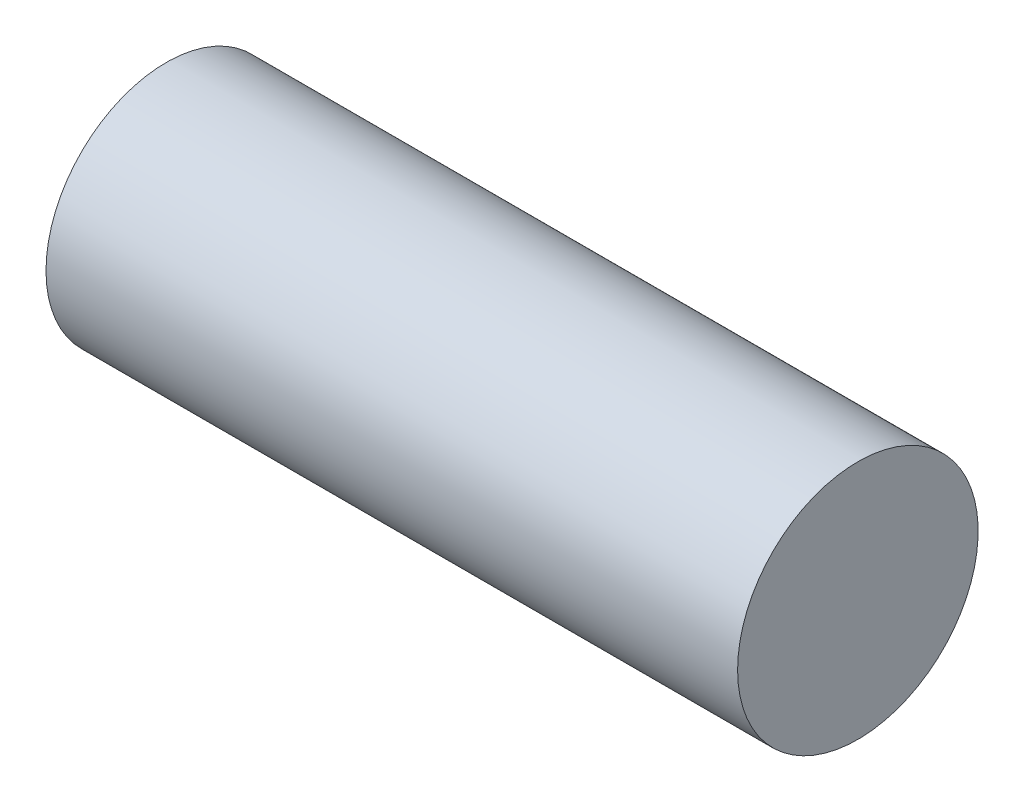
from build123d import *

# Parameters (mm, degrees)
SKETCH2_W = 6.9
SKETCH2_H = 1.2


with BuildPart() as part:
    # Sketch2 → Revolve1 (revolve)
    with BuildSketch(Plane.XY):
        with Locations((-5.705905512, 0.6)):
            Rectangle(SKETCH2_W, SKETCH2_H)
    revolve(axis=Axis((-9.155905512, 0, 0), (1, 0, 0)))


solid = part.part
